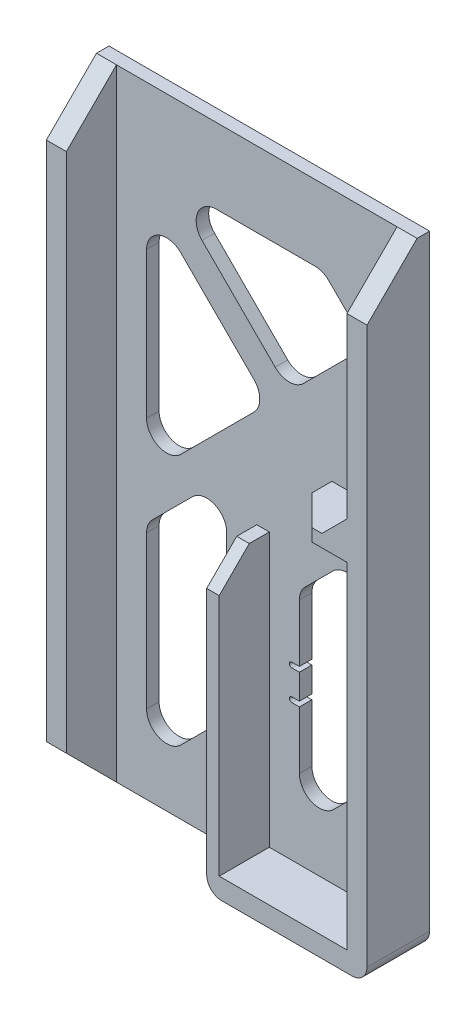
from build123d import *

# Parameters (mm, degrees)
BOSS_EXTRUDE1_DEPTH     = 10
SKETCH1_3_W             = 25.5
SKETCH1_3_H             = 67
BOSS_EXTRUDE2_DEPTH     = 2.5
CHAMFER1_SIZE           = 10
SKETCH2_W               = 15
SKETCH2_H               = 15
CUT_EXTRUDE1_DEPTH      = 10
CHAMFER2_SIZE           = 5
SKETCH3_W               = 28
SKETCH3_H               = 4
CUT_EXTRUDE2_DEPTH      = 10
FILLET2_R               = 3
FILLET3_R               = 3
CHAMFER3_SIZE           = 10
CUT_EXTRUDE3_DEPTH      = 2.5
CHAMFER4_SIZE           = 13.6
FILLET4_R               = 4
CHAMFER5_SIZE           = 6
CUT_EXTRUDE4_DEPTH      = 135.536240471
CUT_EXTRUDE4_DEPTH_BACK = 2.5
FILLET6_R               = 0.5
SKETCH7_W               = 1.5
SKETCH7_H               = 30
CUT_EXTRUDE5_DEPTH      = 2.5
CHAMFER6_SIZE           = 1.5
FILLET7_R               = 0.5


# Some blends are built 0.0001 mm under size
with BuildPart() as part:
    # Sketch1 → Boss-Extrude1 (new body)
    with BuildSketch(Plane.XY):
        Polygon((56, 67), (56, 69.5), (28, 69.5), (28, 0), (30.5, 0), (30.5, 67), align=None)
        Polygon((56, 120), (56, 69.5), (56, 67), (56, 0), (30.5, 0), (28, 0), (0, 0), (0, 120), (-4, 120), (-4, -4), (60, -4), (60, 120), align=None)
    extrude(amount=BOSS_EXTRUDE1_DEPTH)

    # Sketch1<3> → Boss-Extrude2 (add)
    with BuildSketch(Plane.XY):
        Polygon((28, 69.5), (56, 69.5), (56, 120), (0, 120), (0, 0), (28, 0), align=None)
        with Locations((43.25, 33.5)):
            Rectangle(SKETCH1_3_W, SKETCH1_3_H)
        Polygon((56, 120), (56, 69.5), (56, 67), (56, 0), (30.5, 0), (28, 0), (0, 0), (0, 120), (-4, 120), (-4, -4), (60, -4), (60, 120), align=None)
        Polygon((56, 67), (56, 69.5), (28, 69.5), (28, 0), (30.5, 0), (30.5, 67), align=None)
    extrude(amount=-BOSS_EXTRUDE2_DEPTH)

    # Chamfer1
    chamfer1_edges = [part.edges().sort_by_distance(p)[0] for p in [
        (58, 120, 10),
        (-2, 120, 10),
    ]]
    chamfer(chamfer1_edges, length=CHAMFER1_SIZE)

    # Sketch2 → Cut-Extrude1 (cut)
    with BuildSketch(Plane.XY.offset(10)):
        with Locations((35.5, 62)):
            Rectangle(SKETCH2_W, SKETCH2_H)
    extrude(amount=-CUT_EXTRUDE1_DEPTH, mode=Mode.SUBTRACT)

    # Chamfer2
    chamfer2_edges = [part.edges().sort_by_distance(p)[0] for p in [
        (56, 69.5, 5),
    ]]
    chamfer(chamfer2_edges, length=CHAMFER2_SIZE)

    # Sketch3 → Cut-Extrude2 (cut)
    with BuildSketch(Plane.XY.offset(10)):
        with Locations((14, -2)):
            Rectangle(SKETCH3_W, SKETCH3_H)
    extrude(amount=-CUT_EXTRUDE2_DEPTH, mode=Mode.SUBTRACT)

    # Fillet2
    fillet2_edges = [part.edges().sort_by_distance(p)[0] for p in [
        (28, -4, 5),
    ]]
    fillet(fillet2_edges, radius=FILLET2_R)

    # Fillet3
    fillet3_edges = [part.edges().sort_by_distance(p)[0] for p in [
        (60, -4, 3.75),
    ]]
    fillet(fillet3_edges, radius=FILLET3_R)

    # Chamfer3
    chamfer3_edges = [part.edges().sort_by_distance(p)[0] for p in [
        (-2, -4, 10),
    ]]
    chamfer(chamfer3_edges, length=CHAMFER3_SIZE)

    # Sketch4 → Cut-Extrude3 (cut)
    with BuildSketch(Plane.XY):
        Polygon((36.5, 60.5), (36.5, 61), (37, 61), (50, 61), (50, 6), (36.5, 6), align=None)
        Polygon((10.242640687, 105), (41.25, 105), (50, 96.25), (34.496320344, 80.746320344), align=None)
        Polygon((22, 68.25), (30.253679656, 76.503679656), (6, 100.757359313), (6, 52.25), align=None)
        Polygon((22, 59.764718626), (10.242640687, 48.007359313), (6, 43.764718626), (6, 2), (22, 18), align=None)
    extrude(amount=-CUT_EXTRUDE3_DEPTH, mode=Mode.SUBTRACT)

    # Chamfer4
    # the kernel refuses this chamfer: 13.6 mm, written as the material it adds along each edge
    with BuildSketch(Plane(origin=(50, 6, 0), x_dir=(-0.9996219169112968, -0.0274958766105864, 0), z_dir=(0, 0, -1))) as chamfer4_piece_1:
        Polygon((CHAMFER4_SIZE * 0.999621916911, CHAMFER4_SIZE * 0.0274958766106), (-CHAMFER4_SIZE * 0.0274958766106, CHAMFER4_SIZE * 0.999621916911), (0, 0), align=None)
    extrude(amount=2.5)
    with BuildSketch(Plane(origin=(36.5, 61, 0), x_dir=(-0.027495876610586337, -0.9996219169112968, 0), z_dir=(0, 0, -1))) as chamfer4_piece_2:
        Polygon((CHAMFER4_SIZE * 0.999621916911, -CHAMFER4_SIZE * 0.0274958766106), (-CHAMFER4_SIZE * 0.0274958766106, -CHAMFER4_SIZE * 0.999621916911), (0, 0), align=None)
    extrude(amount=2.5)

    # Fillet4
    fillet4_edges = [part.edges().sort_by_distance(p)[0] for p in [
        (22, 18, -1.25),
        (6, 2, -1.25),
        (6, 43.764718626, -1.25),
        (22, 59.764718626, -1.25),
        (6, 52.25, -1.25),
        (6, 100.757359313, -1.25),
        (30.253679656, 76.503679656, -1.25),
        (41.25, 105, -1.25),
        (50, 96.25, -1.25),
        (34.496320344, 80.746320344, -1.25),
        (10.242640687, 105, -1.25),
        (50, 60.9, -1.25),
        (50, 19.6, -1.25),
        (36.5, 47.4, -1.25),
        (36.5, 6.1, -1.25),
    ]]
    fillet(fillet4_edges, radius=FILLET4_R)

    # Chamfer5
    chamfer5_edges = [part.edges().sort_by_distance(p)[0] for p in [
        (29.25, 54.5, 10),
        (43, 68.25, 10),
    ]]
    chamfer(chamfer5_edges, length=CHAMFER5_SIZE)

    # Sketch6 → Cut-Extrude4 (cut, two sides: drawn at the far end of the back side and taken through both)
    with BuildSketch(Plane.XY.offset(-CUT_EXTRUDE4_DEPTH_BACK)):
        Polygon((34.5, 33.25), (36.5, 33.25), (36.5, 33.75), (36.5, 34.25), (34.5, 34.25), align=None)
        Polygon((36.5, 27.25), (36.5, 27.75), (36.5, 28.25), (34.5, 28.25), (34.5, 27.25), align=None)
        Polygon((50, 33.75), (50, 33.25), (50, 32.75), (52, 32.75), (52, 33.75), align=None)
        Polygon((50, 39.25), (50, 38.75), (52, 38.75), (52, 39.75), (50, 39.75), align=None)
    extrude(amount=CUT_EXTRUDE4_DEPTH + CUT_EXTRUDE4_DEPTH_BACK, mode=Mode.SUBTRACT)

    # Fillet6
    fillet6_edges = [part.edges().sort_by_distance(p)[0] for p in [
        (52, 38.75, -1.25),
        (52, 39.75, -1.25),
        (34.5, 27.25, -1.25),
        (34.5, 28.25, -1.25),
        (34.5, 33.25, -1.25),
        (34.5, 34.25, -1.25),
    ]]
    fillet(fillet6_edges, radius=FILLET6_R - 0.0001)  # a hair under: the kernel refuses the full size

    # Sketch7 → Cut-Extrude5 (cut)
    with BuildSketch(Plane.XY):
        with Locations((27.25, 29.600220455)):
            Rectangle(SKETCH7_W, SKETCH7_H)
    extrude(amount=-CUT_EXTRUDE5_DEPTH, mode=Mode.SUBTRACT)

    # Chamfer6
    chamfer6_edges = [part.edges().sort_by_distance(p)[0] for p in [
        (28, 14.600220455, -1.25),
        (26.5, 44.600220455, -1.25),
    ]]
    chamfer(chamfer6_edges, length=CHAMFER6_SIZE - 0.0001)  # a hair under: the kernel refuses the full size

    # Fillet7
    fillet7_edges = [part.edges().sort_by_distance(p)[0] for p in [
        (52, 32.75, -1.25),
        (52, 33.75, -1.25),
    ]]
    fillet(fillet7_edges, radius=FILLET7_R - 0.0001)  # a hair under: the kernel refuses the full size


solid = part.part
